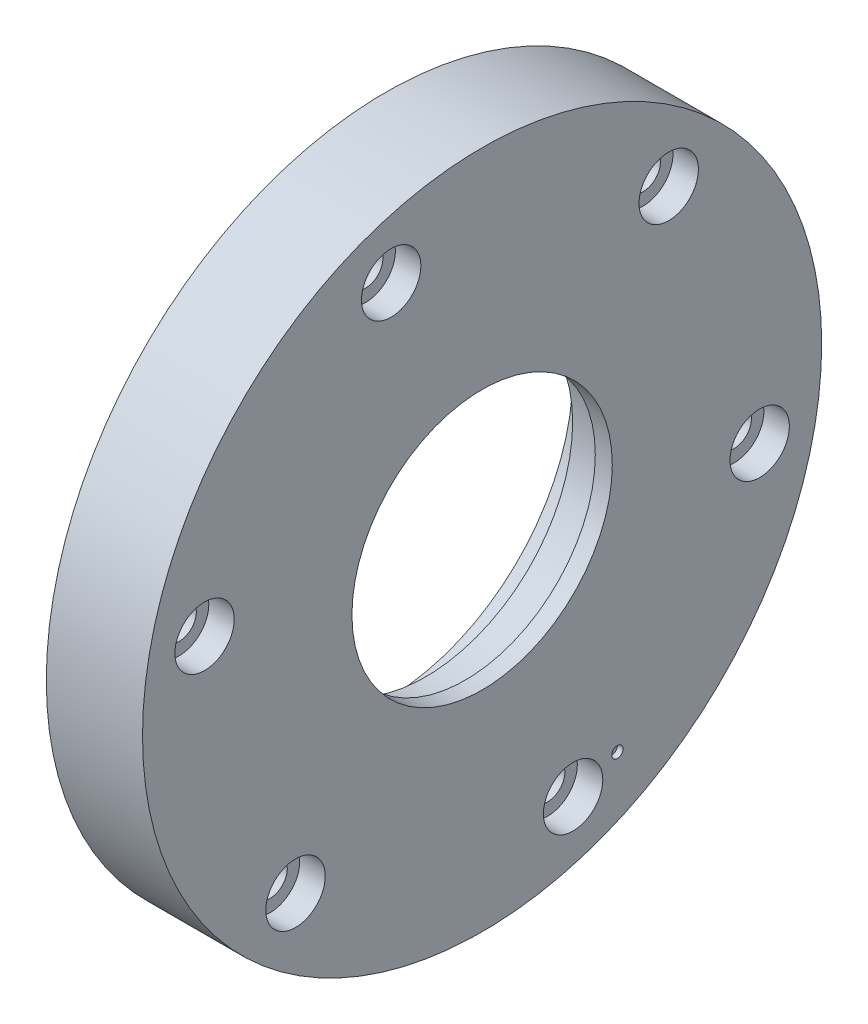
from build123d import *

# Parameters (mm, degrees)
SKETCH2_R          = 2.5
CUT_EXTRUDE1_DEPTH = 4
SKETCH3_R          = 3.05
CUT_EXTRUDE4_DEPTH = 87.539008545
SKETCH4_R          = 5.25
CUT_EXTRUDE5_DEPTH = 4.5
SKETCH6_R          = 1
CUT_EXTRUDE7_DEPTH = 1


with BuildPart() as part:
    # Sketch1 → Revolve1 (revolve)
    with BuildSketch(Plane.XY):
        Polygon((0, 60), (0, 33), (7, 33), (7, 26), (14, 26), (14, 23), (17, 23), (17, 60), align=None)
    revolve(axis=Axis((0, 0, 0), (1, 0, 0)))

    # Sketch2 → Cut-Extrude1 (cut)
    with BuildSketch(Plane.ZY):
        with Locations((0, 40)):
            Circle(SKETCH2_R)
        with Locations((15.307337295, 36.9551813)):
            Circle(SKETCH2_R)
        with Locations((28.284271247, 28.284271247)):
            Circle(SKETCH2_R)
        with Locations((36.9551813, 15.307337295)):
            Circle(SKETCH2_R)
        with Locations((40, 0)):
            Circle(SKETCH2_R)
        with Locations((36.9551813, -15.307337295)):
            Circle(SKETCH2_R)
        with Locations((28.284271247, -28.284271247)):
            Circle(SKETCH2_R)
        with Locations((15.307337295, -36.9551813)):
            Circle(SKETCH2_R)
        with Locations((0, -40)):
            Circle(SKETCH2_R)
        with Locations((-15.307337295, -36.9551813)):
            Circle(SKETCH2_R)
        with Locations((-28.284271247, -28.284271247)):
            Circle(SKETCH2_R)
        with Locations((-36.9551813, -15.307337295)):
            Circle(SKETCH2_R)
        with Locations((-40, 0)):
            Circle(SKETCH2_R)
        with Locations((-36.9551813, 15.307337295)):
            Circle(SKETCH2_R)
        with Locations((-28.284271247, 28.284271247)):
            Circle(SKETCH2_R)
        with Locations((-15.307337295, 36.9551813)):
            Circle(SKETCH2_R)
    extrude(amount=-CUT_EXTRUDE1_DEPTH, mode=Mode.SUBTRACT)

    # Sketch3 → Cut-Extrude4 (cut, through all)
    with BuildSketch(Plane(origin=(17, 0, 0), x_dir=(0, 0, -1), z_dir=(1, 0, 0))):
        with Locations((49.03926402, -9.754516101)):
            Circle(SKETCH3_R)
        with Locations((16.071973265, -47.346506475)):
            Circle(SKETCH3_R)
        with Locations((-32.967290755, -37.591990374)):
            Circle(SKETCH3_R)
        with Locations((-49.03926402, 9.754516101)):
            Circle(SKETCH3_R)
        with Locations((-16.071973265, 47.346506475)):
            Circle(SKETCH3_R)
        with Locations((32.967290755, 37.591990374)):
            Circle(SKETCH3_R)
    extrude(amount=-CUT_EXTRUDE4_DEPTH, mode=Mode.SUBTRACT)

    # Sketch4 → Cut-Extrude5 (cut)
    with BuildSketch(Plane(origin=(17, 0, 0), x_dir=(0, 0, -1), z_dir=(1, 0, 0))):
        with Locations((32.967290755, 37.591990374)):
            Circle(SKETCH4_R)
        with Locations((49.03926402, -9.754516101)):
            Circle(SKETCH4_R)
        with Locations((16.071973265, -47.346506475)):
            Circle(SKETCH4_R)
        with Locations((-32.967290755, -37.591990374)):
            Circle(SKETCH4_R)
        with Locations((-49.03926402, 9.754516101)):
            Circle(SKETCH4_R)
        with Locations((-16.071973265, 47.346506475)):
            Circle(SKETCH4_R)
    extrude(amount=-CUT_EXTRUDE5_DEPTH, mode=Mode.SUBTRACT)

    # Sketch6 → Cut-Extrude7 (cut)
    with BuildSketch(Plane(origin=(17, 0, 0), x_dir=(0, 0, -1), z_dir=(1, 0, 0))):
        with Locations((23.905313753, -44.425227151)):
            Circle(SKETCH6_R)
    extrude(amount=-CUT_EXTRUDE7_DEPTH, mode=Mode.SUBTRACT)


solid = part.part
